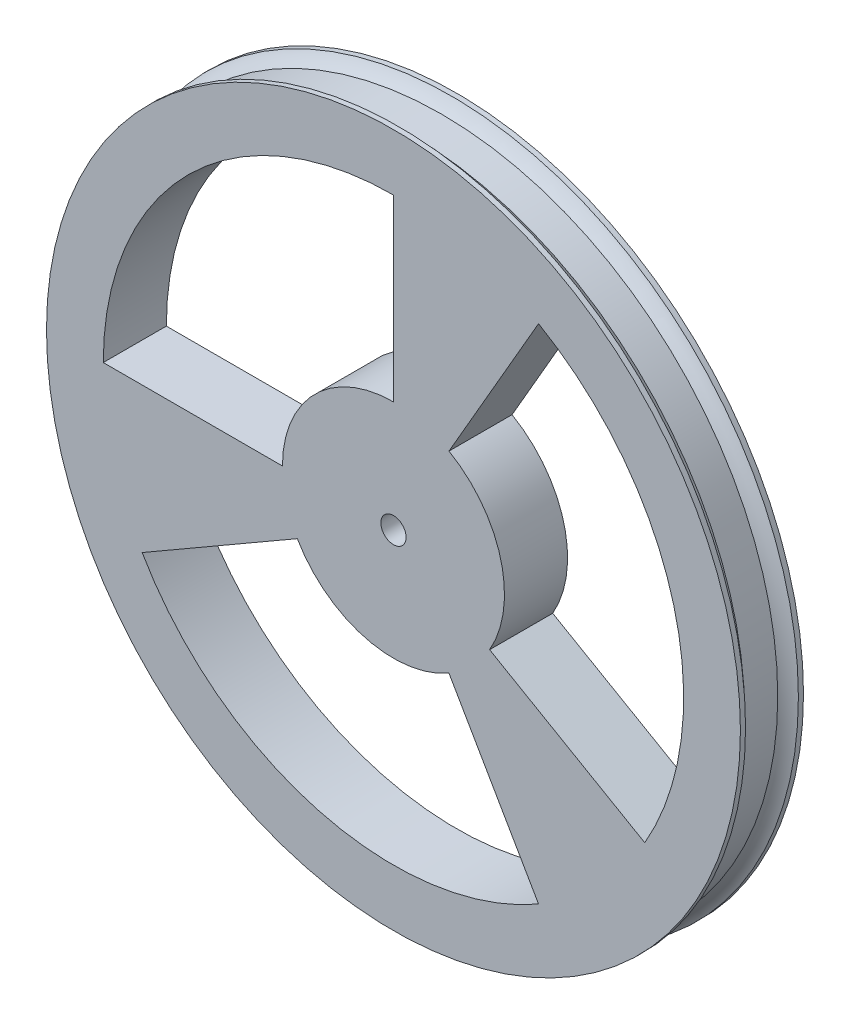
from build123d import *

# Parameters (mm, degrees)
ESBO_O1_R                = 27.5
RESSALTO_EXTRUS_O1_DEPTH = 5
ESBO_O9_R                = 1
CORTE_EXTRUS_O1_DEPTH    = 5
CORTE_EXTRUS_O2_DEPTH    = 5


with BuildPart() as part:
    # Esboço1 → Ressalto-extrusão1 (new body)
    with BuildSketch(Plane.XY):
        Circle(ESBO_O1_R)
    extrude(amount=RESSALTO_EXTRUS_O1_DEPTH)

    # Esboço7 → Corte-Revolução4 (revolve, cut)
    with BuildSketch(Plane(origin=(0, 0, 0), x_dir=(0, 0, -1), z_dir=(1, 0, 0))):
        with BuildLine():
            ThreePointArc((-0.112348688, 28.646890778), (-3.63505257, 30.747494132), (-3.808478377, 26.649701973))
            Line((-3.808478377, 26.649701973), (-1.191521623, 26.649701973))
            ThreePointArc((-1.191521623, 26.649701973), (-0.399396646, 27.511838208), (-0.112348688, 28.646890778))
        make_face()
    revolve(axis=Axis((0, 0, 5), (0, 0, -1)), mode=Mode.SUBTRACT)

    # Esboço9 → Corte-extrusão1 (cut)
    with BuildSketch(Plane.XY.offset(5)):
        Circle(ESBO_O9_R)
    extrude(amount=-CORTE_EXTRUS_O1_DEPTH, mode=Mode.SUBTRACT)

    # Esboço10 → Corte-extrusão2 (cut)
    with BuildSketch(Plane.XY.offset(5)):
        with BuildLine():
            ThreePointArc((-8.8, 0), (-6.222539674, 6.222539674), (0, 8.8))
            Line((0, 8.8), (0, 23))
            ThreePointArc((0, 23), (-16.263455967, 16.263455967), (-23, 0))
            Line((-23, 0), (-8.8, 0))
        make_face()
        with BuildLine():
            Line((11.5, 19.918584287), (4.4, 7.621023553))
            ThreePointArc((4.4, 7.621023553), (8.500147271, 2.277607597), (7.621023553, -4.4))
            Line((7.621023553, -4.4), (19.918584287, -11.5))
            ThreePointArc((19.918584287, -11.5), (22.216294005, 5.952838037), (11.5, 19.918584287))
        make_face()
        with BuildLine():
            ThreePointArc((4.4, -7.621023553), (-2.277607597, -8.500147271), (-7.621023553, -4.4))
            Line((-7.621023553, -4.4), (-19.918584287, -11.5))
            ThreePointArc((-19.918584287, -11.5), (-5.952838037, -22.216294005), (11.5, -19.918584287))
            Line((11.5, -19.918584287), (4.4, -7.621023553))
        make_face()
    extrude(amount=-CORTE_EXTRUS_O2_DEPTH, mode=Mode.SUBTRACT)


solid = part.part
